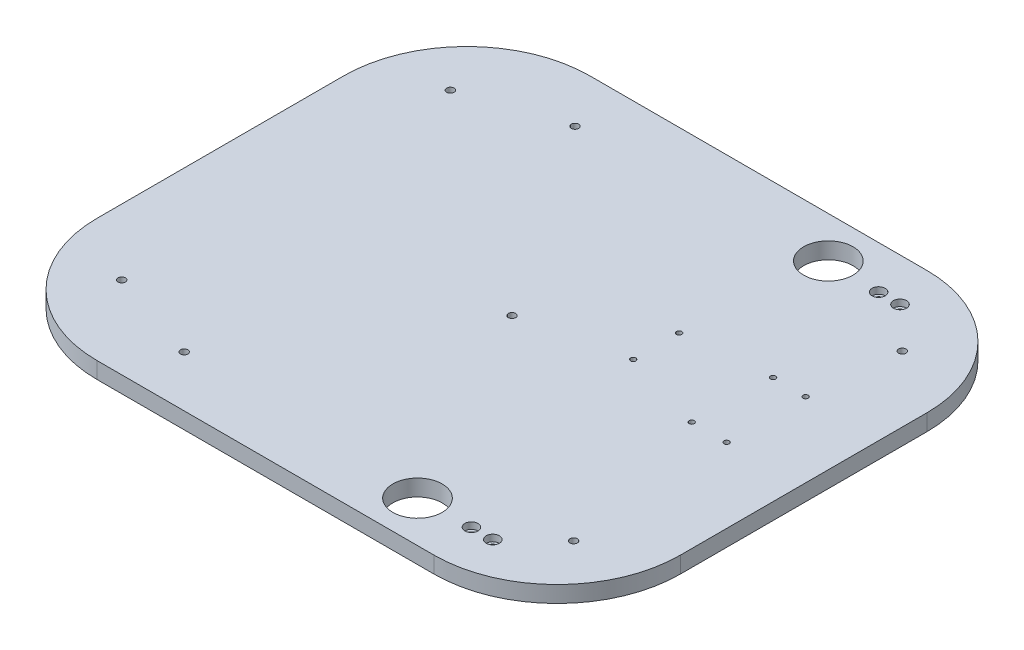
from build123d import *

# Parameters (mm, degrees)
SKETCH11_W                     = 355
SKETCH11_H                     = 300
SKETCH11_R                     = 15
BOSS_EXTRUDE2_DEPTH            = 10
CBORE_FOR_M4_SHCS2_D           = 4.5
CBORE_FOR_M4_SHCS2_CBORE_D     = 8
CBORE_FOR_M4_SHCS2_CBORE_DEPTH = 4
F_3_2_3_2_DIAMETER_HOLE2_D     = 3.2
M4_CLEARANCE_HOLE1_OUTLINE_R   = 2.25
M4_CLEARANCE_HOLE1_DEPTH       = 10
M4_CLEARANCE_HOLE2_D           = 4.5
FILLET1_R                      = 75


# Read off the part's stored shape, not the designer's step: M4 Clearance Hole1
with BuildPart() as part:
    # Sketch11 → Boss-Extrude2 (new body)
    with BuildSketch(Plane(origin=(0, 0, 0), x_dir=(1, 0, 0), z_dir=(0, 1, 0))):
        Rectangle(SKETCH11_W, SKETCH11_H)
        with Locations(Location((67.5, -125, 0), (0, 0, 270))):
            Circle(SKETCH11_R, mode=Mode.SUBTRACT)
        with Locations(Location((67.5, 125, 0), (0, 0, 270))):
            Circle(SKETCH11_R, mode=Mode.SUBTRACT)
    extrude(amount=BOSS_EXTRUDE2_DEPTH)

    # CBORE for M4 SHCS2 (through all)
    with Locations(Plane(origin=(0, 10, 0), x_dir=(1, 0, 0), z_dir=(0, 1, 0))):
        with Locations((99.2, 123.9), (112.2, 123.9), (112.2, -123.9), (99.2, -123.9)):
            CounterBoreHole(CBORE_FOR_M4_SHCS2_D / 2, CBORE_FOR_M4_SHCS2_CBORE_D / 2, CBORE_FOR_M4_SHCS2_CBORE_DEPTH)

    # Ø3.2 (3.2) Diameter Hole2 (through all)
    with Locations(Plane(origin=(0, 10, 0), x_dir=(1, 0, 0), z_dir=(0, 1, 0))):
        with Locations((132.110460528, 46.535002739), (112.111563058, 46.745002739), (110.841563058, -1.514997261), (132.110460528, -1.514997261), (60.041563058, 13.725002739), (60.041563058, 41.665002739)):
            Hole(F_3_2_3_2_DIAMETER_HOLE2_D / 2)

    # M4 Clearance Hole1 outline → M4 Clearance Hole1 (cut)
    with BuildSketch(Plane(origin=(0, 0, 0), x_dir=(1, 0, 0), z_dir=(0, 1, 0))):
        with Locations((137.5, 100)):
            Circle(M4_CLEARANCE_HOLE1_OUTLINE_R)
        with Locations((-137.5, -100)):
            Circle(M4_CLEARANCE_HOLE1_OUTLINE_R)
        with Locations((-137.5, 100)):
            Circle(M4_CLEARANCE_HOLE1_OUTLINE_R)
        with Locations((137.5, -100)):
            Circle(M4_CLEARANCE_HOLE1_OUTLINE_R)
        Circle(M4_CLEARANCE_HOLE1_OUTLINE_R)
    extrude(amount=M4_CLEARANCE_HOLE1_DEPTH, mode=Mode.SUBTRACT)

    # M4 Clearance Hole2 (through all)
    with Locations(Plane(origin=(0, 10, 0), x_dir=(1, 0, 0), z_dir=(0, 1, 0))):
        with Locations((-80.554499739, -118.9), (-80.554499739, 118.9)):
            Hole(M4_CLEARANCE_HOLE2_D / 2)

    # Fillet1
    fillet1_edges = [part.edges().sort_by_distance(p)[0] for p in [
        (177.5, 5, -150),
        (177.5, 5, 150),
        (-177.5, 5, 150),
        (-177.5, 5, -150),
    ]]
    fillet(fillet1_edges, radius=FILLET1_R)


solid = part.part
